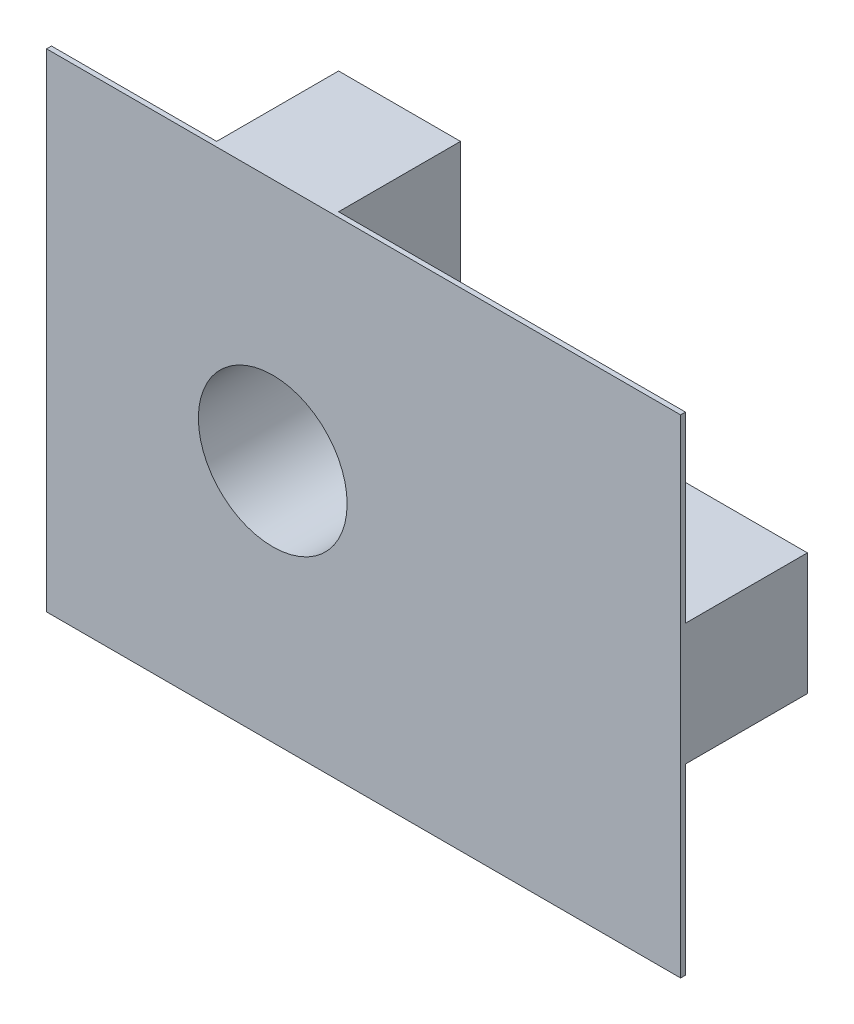
from build123d import *
from build123d.topology import SkipClean

# Parameters (mm, degrees)
SKETCH_1_W      = 260
SKETCH_1_H      = 200
SKETCH_1_R      = 30.5
EXTRUDE_1_DEPTH = 2
EXTRUDE_START   = 50
SKETCH_2_R      = 30.5
EXTRUDE_5_DEPTH = 50


with BuildPart() as part:
    # Эскиз1 → Бобышка-Вытянуть1 (new body)
    with BuildSketch(Plane.XY):
        Rectangle(SKETCH_1_W, SKETCH_1_H)
        with Locations((-37.26, 0)):
            Circle(SKETCH_1_R, mode=Mode.SUBTRACT)
    extrude(amount=EXTRUDE_1_DEPTH)

    # Эскиз2 → Бобышка-Вытянуть5 (add)
    with SkipClean():  # the faces are left unmerged after this step: merging them gives an invalid solid
        with BuildSketch(Plane(origin=(0, 0, 0), x_dir=(-1, 0, 0), z_dir=(0, 0, -1)).offset(EXTRUDE_START)):
            Polygon((12.26, 25), (-130, 25), (-130, -25), (12.26, -25), (12.26, -100), (62.26, -100), (62.26, -25), (130, -25), (130, 25), (62.26, 25), (62.26, 100), (12.26, 100), align=None)
            with Locations((37.26, 0)):
                Circle(SKETCH_2_R, mode=Mode.SUBTRACT)
        extrude(amount=-EXTRUDE_5_DEPTH)


solid = part.part
